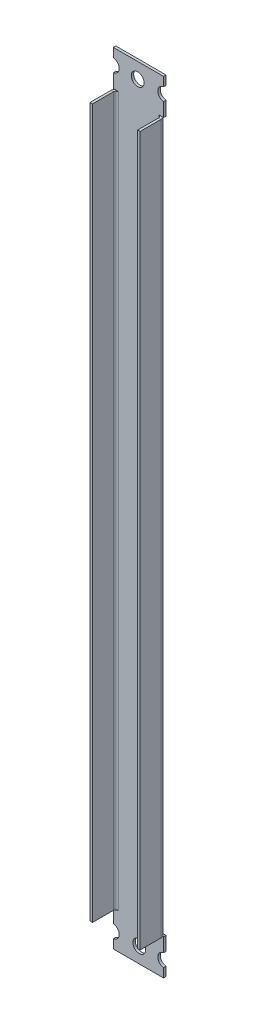
from build123d import *

# Parameters (mm, degrees)
CROQUIS1_W                          = 30.988
CROQUIS1_H                          = 482.6
CROQUIS1_R                          = 3.9624
BRIDA_BASE1_DEPTH                   = 1.524
BRIDA_DE_ARISTA1_STRIP_W            = 9.144
BRIDA_DE_ARISTA1_STRIP_H            = 1.524
BRIDA_DE_ARISTA1_STRIP_CUT_DEPTH    = 438.15
BRIDA_DE_ARISTA1_RELIEF_W           = 9.2964
BRIDA_DE_ARISTA1_RELIEF_H           = 0.1524
BRIDA_DE_ARISTA1_RELIEF_CUT_DEPTH   = 1.524
BRIDA_DE_ARISTA1_STRIP_2_W          = 9.144
BRIDA_DE_ARISTA1_STRIP_2_H          = 1.524
BRIDA_DE_ARISTA1_STRIP_CUT_2_DEPTH  = 438.15
BRIDA_DE_ARISTA1_RELIEF_2_W         = 9.2964
BRIDA_DE_ARISTA1_RELIEF_2_H         = 0.1524
BRIDA_DE_ARISTA1_RELIEF_CUT_2_DEPTH = 1.524
BRIDA_DE_ARISTA1_DEPTH              = 438.15
BRIDA_DE_ARISTA1_BEND_DEPTH         = 438.15
CROQUIS15_R                         = 3.9624
CORTAR_EXTRUIR1_DEPTH               = 243.229986831


# Sheet-metal steps are written as plain solids
with BuildPart() as part:
    # Croquis1 → Brida base1 (new body)
    with BuildSketch(Plane.XY):
        Rectangle(CROQUIS1_W, CROQUIS1_H)
        with Locations((-0.508, 231.775)):
            Circle(CROQUIS1_R, mode=Mode.SUBTRACT)
        with Locations((0.508, -231.775)):
            Circle(CROQUIS1_R, mode=Mode.SUBTRACT)
    extrude(amount=-BRIDA_BASE1_DEPTH)

    # Brida de arista1 strip (across the edge) → Brida de arista1 strip cut (cut)
    with BuildSketch(Plane(origin=(15.494, -219.075, 0), x_dir=(-1, 0, 0), z_dir=(0, 1, 0))):
        with Locations((-1.524, -0.762)):
            Rectangle(BRIDA_DE_ARISTA1_STRIP_W, BRIDA_DE_ARISTA1_STRIP_H)
    extrude(amount=BRIDA_DE_ARISTA1_STRIP_CUT_DEPTH, mode=Mode.SUBTRACT)

    # Brida de arista1 relief (on the sheet) → Brida de arista1 relief cut (cut)
    with BuildSketch(Plane(origin=(12.446, -219.075, 0), x_dir=(-1, 0, 0), z_dir=(0, 0, 1))):
        with Locations((-4.4958, 0.0762)):
            Rectangle(BRIDA_DE_ARISTA1_RELIEF_W, BRIDA_DE_ARISTA1_RELIEF_H)
        with Locations((-4.4958, -438.2262)):
            Rectangle(BRIDA_DE_ARISTA1_RELIEF_W, BRIDA_DE_ARISTA1_RELIEF_H)
    extrude(amount=-BRIDA_DE_ARISTA1_RELIEF_CUT_DEPTH, mode=Mode.SUBTRACT)

    # Brida de arista1 strip 2 (across the edge) → Brida de arista1 strip cut 2 (cut)
    with BuildSketch(Plane(origin=(-15.494, 219.075, 0), x_dir=(1, 0, 0), z_dir=(0, -1, 0))):
        with Locations((-1.524, -0.762)):
            Rectangle(BRIDA_DE_ARISTA1_STRIP_2_W, BRIDA_DE_ARISTA1_STRIP_2_H)
    extrude(amount=BRIDA_DE_ARISTA1_STRIP_CUT_2_DEPTH, mode=Mode.SUBTRACT)

    # Brida de arista1 relief 2 (on the sheet) → Brida de arista1 relief cut 2 (cut)
    with BuildSketch(Plane(origin=(-12.446, 219.075, 0), x_dir=(1, 0, 0), z_dir=(0, 0, 1))):
        with Locations((-4.4958, 0.0762)):
            Rectangle(BRIDA_DE_ARISTA1_RELIEF_2_W, BRIDA_DE_ARISTA1_RELIEF_2_H)
        with Locations((-4.4958, -438.2262)):
            Rectangle(BRIDA_DE_ARISTA1_RELIEF_2_W, BRIDA_DE_ARISTA1_RELIEF_2_H)
    extrude(amount=-BRIDA_DE_ARISTA1_RELIEF_CUT_2_DEPTH, mode=Mode.SUBTRACT)

    # Brida de arista1 section (across the edge) → Brida de arista1 (add)
    with BuildSketch(Plane(origin=(15.494, -219.075, 0), x_dir=(-1, 0, 0), z_dir=(0, 1, 0))):
        with BuildLine():
            Line((0, 1.524), (0, 14.478))
            Line((0, 14.478), (1.524, 14.478))
            Line((1.524, 14.478), (1.524, 1.524))
            ThreePointArc((1.524, 1.524), (1.970369265, 0.446369265), (3.048, 0))
            Line((3.048, 0), (3.048, -1.524))
            ThreePointArc((3.048, -1.524), (0.892738531, -0.631261469), (0, 1.524))
        make_face()
    extrude(amount=BRIDA_DE_ARISTA1_DEPTH)

    # Brida de arista1 section 2 (across the edge) → Brida de arista1 bend (add)
    with BuildSketch(Plane(origin=(-15.494, 219.075, 0), x_dir=(1, 0, 0), z_dir=(0, -1, 0))):
        with BuildLine():
            Line((0, 1.524), (0, 14.478))
            Line((0, 14.478), (1.524, 14.478))
            Line((1.524, 14.478), (1.524, 1.524))
            ThreePointArc((1.524, 1.524), (1.970369265, 0.446369265), (3.048, 0))
            Line((3.048, 0), (3.048, -1.524))
            ThreePointArc((3.048, -1.524), (0.892738531, -0.631261469), (0, 1.524))
        make_face()
    extrude(amount=BRIDA_DE_ARISTA1_BEND_DEPTH)

    # Croquis15 → Cortar-Extruir1 (cut, through all)
    with BuildSketch(Plane.XY):
        with Locations((-15.9004, 231.775)):
            Circle(CROQUIS15_R)
        with Locations((-15.9004, -231.775)):
            Circle(CROQUIS15_R)
        with Locations((15.9004, -231.775)):
            Circle(CROQUIS15_R)
        with Locations((15.9004, 231.775)):
            Circle(CROQUIS15_R)
    extrude(amount=-CORTAR_EXTRUIR1_DEPTH, mode=Mode.SUBTRACT)


solid = part.part
